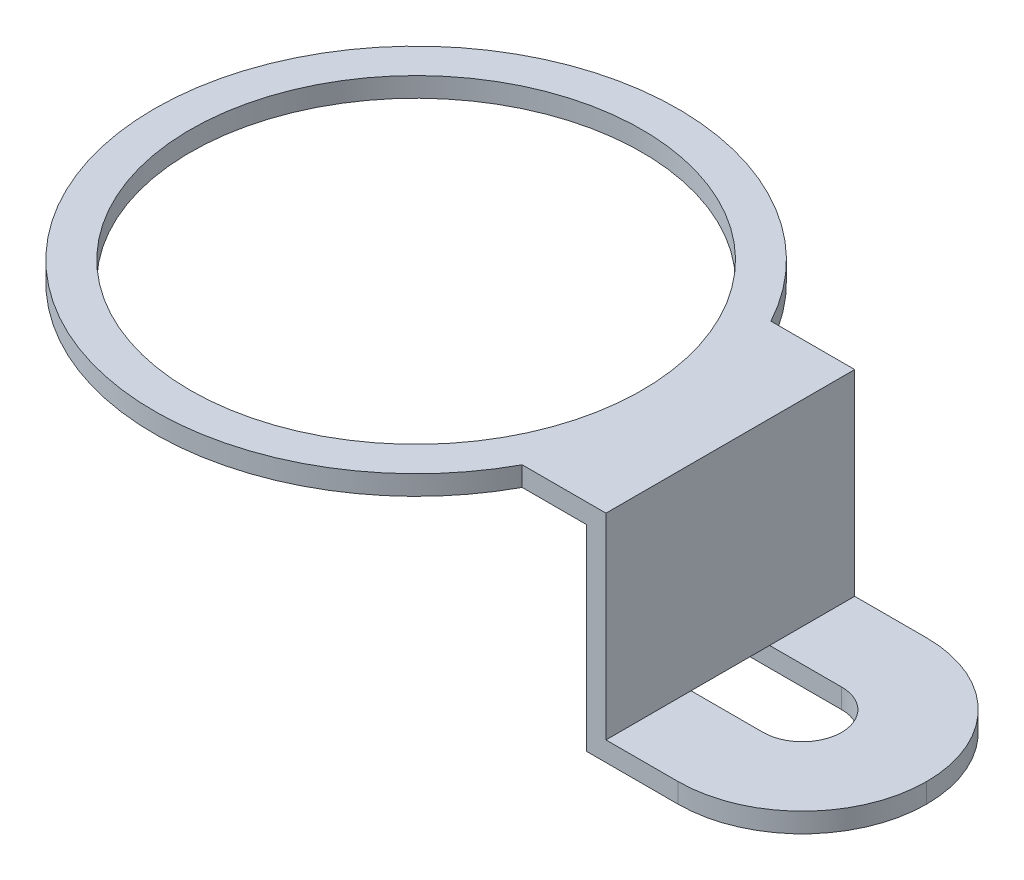
from build123d import *

# Parameters (mm, degrees)
SKETCH_1_R          = 3.45
EXTRUDE_1_DEPTH     = 0.3
SKETCH_2_W          = 8.378641338
SKETCH_2_H          = 6.913843901
CUT_EXTRUDE_1_DEPTH = 10
EXTRUDE_2_DEPTH     = 3.8
FILLET_1_R          = 1.9
CUT_EXTRUDE_2_DEPTH = 10


with BuildPart() as part:
    # 草图1 → 凸台-拉伸1 (new body)
    with BuildSketch(Plane(origin=(0, 0, 0), x_dir=(1, 0, 0), z_dir=(0, 1, 0))):
        with BuildLine():
            Line((3.519943181, 1.9), (10, 1.9))
            ThreePointArc((10, 1.9), (11.9, 0), (10, -1.9))
            Line((10, -1.9), (3.519943181, -1.9))
            ThreePointArc((3.519943181, -1.9), (-4, 0), (3.519943181, 1.9))
        make_face()
        with Locations(Location((0, 0, 0), (0, 0, 270))):
            Circle(SKETCH_1_R, mode=Mode.SUBTRACT)
        with BuildLine():
            Line((10, -0.6), (8.5, -0.6))
            ThreePointArc((8.5, -0.6), (7.9, 0), (8.5, 0.6))
            Line((8.5, 0.6), (10, 0.6))
            ThreePointArc((10, 0.6), (10.6, 0), (10, -0.6))
        make_face(mode=Mode.SUBTRACT)
    extrude(amount=EXTRUDE_1_DEPTH)

    # 草图2 → 切除-拉伸1 (cut)
    with BuildSketch(Plane(origin=(0, 0.3, 0), x_dir=(1, 0, 0), z_dir=(0, 1, 0))):
        with Locations((8.689320669, -0.04590274)):
            Rectangle(SKETCH_2_W, SKETCH_2_H)
    extrude(amount=-CUT_EXTRUDE_1_DEPTH, mode=Mode.SUBTRACT)

    # 草图3 → 凸台-拉伸2 (add)
    with BuildSketch(Plane.XY.offset(1.9)):
        Polygon((4.5, 0.3), (4.8, 0.3), (4.8, -2.7), (7.8, -2.7), (7.8, -3), (4.5, -3), (4.5, 0), align=None)
    extrude(amount=-EXTRUDE_2_DEPTH)

    # 圆角1
    fillet_1_edges = [part.edges().sort_by_distance(p)[0] for p in [
        (7.8, -2.85, -1.9),
        (7.8, -2.85, 1.9),
    ]]
    fillet(fillet_1_edges, radius=FILLET_1_R - 0.0001)  # a hair under: the kernel refuses the full size

    # 草图4 → 切除-拉伸2 (cut)
    with BuildSketch(Plane(origin=(0, -2.7, 0), x_dir=(1, 0, 0), z_dir=(0, 1, 0))):
        with BuildLine():
            Line((5.9, -0.6), (4.4, -0.6))
            ThreePointArc((4.4, -0.6), (3.8, 0), (4.4, 0.6))
            Line((4.4, 0.6), (5.9, 0.6))
            ThreePointArc((5.9, 0.6), (6.5, 0), (5.9, -0.6))
        make_face()
    extrude(amount=-CUT_EXTRUDE_2_DEPTH, mode=Mode.SUBTRACT)


solid = part.part
